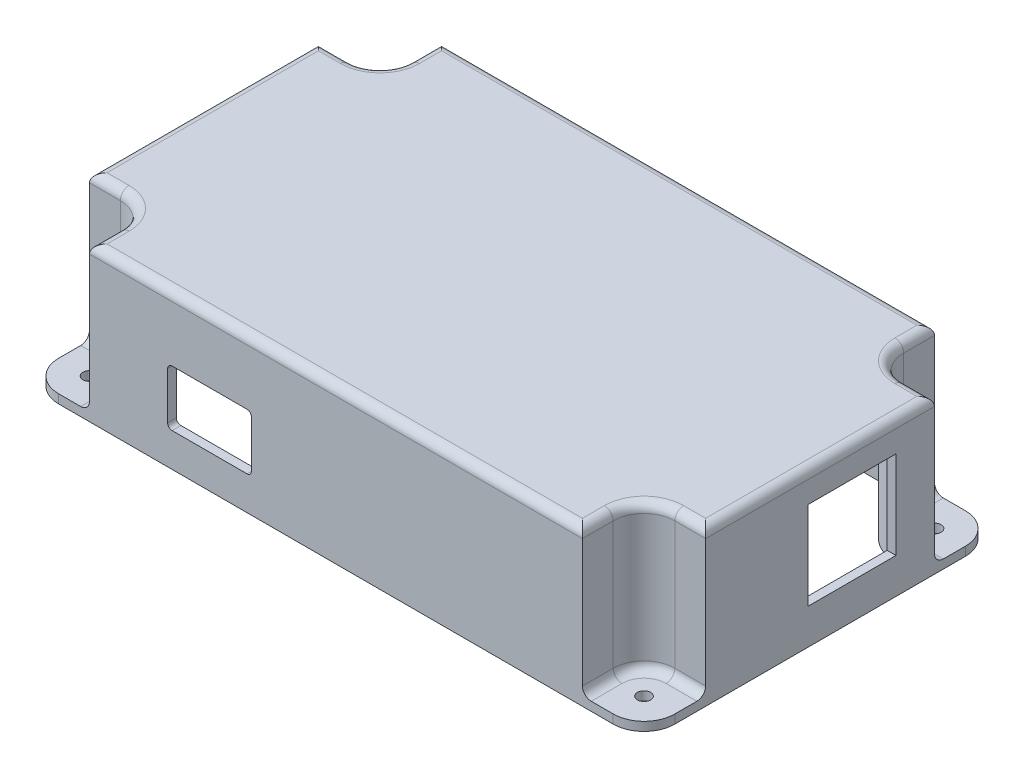
from build123d import *

# Parameters (mm, degrees)
BOSS_EXTRUDE3_DEPTH     = 35
CUT_EXTRUDE4_START      = -33
CUT_EXTRUDE4_DEPTH      = 33
SHELL3_DEPTH            = 33
BOSS_EXTRUDE5_START     = 1
BOSS_EXTRUDE5_DEPTH     = 1
CUT_EXTRUDE5_DEPTH      = 88.114866699
CUT_EXTRUDE5_DEPTH_BACK = 88.114866699
SKETCH10_R              = 1.5
FILLET6_R               = 2
FILLET8_R               = 2
CUT_EXTRUDE7_REACH      = 151.75
SKETCH13_W              = 20
SKETCH13_H              = 20
CUT_EXTRUDE10_REACH     = 113.915
SKETCH16_W              = 19.05
SKETCH16_H              = 12.7
FILLET11_R              = 1


# Read off the part's stored shape, not the designer's step: Shell3
with BuildPart() as part:
    # Sketch4 → Boss-Extrude3 (new body)
    with BuildSketch(Plane(origin=(0, 0, 0), x_dir=(1, 0, 0), z_dir=(0, 1, 0))):
        with BuildLine():
            Line((-63, 40), (63, 40))
            ThreePointArc((63, 40), (67.949747468, 37.949747468), (70, 33))
            Line((70, 33), (70, -33))
            ThreePointArc((70, -33), (67.949747468, -37.949747468), (63, -40))
            Line((63, -40), (-63, -40))
            ThreePointArc((-63, -40), (-67.949747468, -37.949747468), (-70, -33))
            Line((-70, -33), (-70, 33))
            ThreePointArc((-70, 33), (-67.949747468, 37.949747468), (-63, 40))
        make_face()
    extrude(amount=BOSS_EXTRUDE3_DEPTH)

    # Sketch9 → Cut-Extrude4 (cut)
    with BuildSketch(Plane(origin=(0, 35, 0), x_dir=(1, 0, 0), z_dir=(0, 1, 0)).offset(CUT_EXTRUDE4_START)):
        with BuildLine():
            Line((-63, 26), (-70, 26))
            Line((-70, 26), (-70, 33))
            ThreePointArc((-70, 33), (-67.949747468, 37.949747468), (-63, 40))
            Line((-63, 40), (-56, 40))
            Line((-56, 40), (-56, 33))
            ThreePointArc((-56, 33), (-58.050252532, 28.050252532), (-63, 26))
        make_face()
        with BuildLine():
            Line((-63, -26), (-70, -26))
            Line((-70, -26), (-70, -33))
            ThreePointArc((-70, -33), (-67.949747468, -37.949747468), (-63, -40))
            Line((-63, -40), (-56, -40))
            Line((-56, -40), (-56, -33))
            ThreePointArc((-56, -33), (-58.050252532, -28.050252532), (-63, -26))
        make_face()
        with BuildLine():
            Line((56, -33), (56, -40))
            Line((56, -40), (63, -40))
            ThreePointArc((63, -40), (67.949747468, -37.949747468), (70, -33))
            Line((70, -33), (70, -26))
            Line((70, -26), (63, -26))
            ThreePointArc((63, -26), (58.050252532, -28.050252532), (56, -33))
        make_face()
        with BuildLine():
            Line((56, 33), (56, 40))
            Line((56, 40), (63, 40))
            ThreePointArc((63, 40), (67.949747468, 37.949747468), (70, 33))
            Line((70, 33), (70, 26))
            Line((70, 26), (63, 26))
            ThreePointArc((63, 26), (58.050252532, 28.050252532), (56, 33))
        make_face()
    extrude(amount=CUT_EXTRUDE4_DEPTH, mode=Mode.SUBTRACT)

    # Shell3 outline → Shell3 (cut)
    with BuildSketch(Plane(origin=(0, 0, 0), x_dir=(1, 0, 0), z_dir=(0, 1, 0))):
        with BuildLine():
            Line((-68, 24), (-68, -25.516685226))
            ThreePointArc((-68, -25.516685226), (-56.636038969, -26.636038969), (-55.516685226, -38))
            Line((-55.516685226, -38), (55.516685226, -38))
            ThreePointArc((55.516685226, -38), (56.636038969, -26.636038969), (68, -25.516685226))
            Line((68, -25.516685226), (68, 24))
            Line((68, 24), (63, 24))
            ThreePointArc((63, 24), (56.636038969, 26.636038969), (54, 33))
            Line((54, 33), (54, 38))
            Line((54, 38), (-54, 38))
            Line((-54, 38), (-54, 33))
            ThreePointArc((-54, 33), (-56.636038969, 26.636038969), (-63, 24))
            Line((-63, 24), (-68, 24))
        make_face()
    extrude(amount=SHELL3_DEPTH, mode=Mode.SUBTRACT)

    # Sketch11 → Boss-Extrude5 (add)
    with BuildSketch(Plane.XZ.offset(-1).offset(BOSS_EXTRUDE5_START)):
        with BuildLine():
            Line((68, 24), (63, 24))
            ThreePointArc((63, 24), (56.636038969, 26.636038969), (54, 33))
            Line((54, 33), (54, 38))
            Line((54, 38), (63, 38))
            ThreePointArc((63, 38), (66.535533906, 36.535533906), (68, 33))
            Line((68, 33), (68, 24))
        make_face()
        with BuildLine():
            Line((54, -33), (54, -38))
            Line((54, -38), (63, -38))
            ThreePointArc((63, -38), (66.535533906, -36.535533906), (68, -33))
            Line((68, -33), (68, -24))
            Line((68, -24), (63, -24))
            ThreePointArc((63, -24), (56.636038969, -26.636038969), (54, -33))
        make_face()
        with BuildLine():
            Line((-63, -24), (-68, -24))
            Line((-68, -24), (-68, -33))
            ThreePointArc((-68, -33), (-66.535533906, -36.535533906), (-63, -38))
            Line((-63, -38), (-54, -38))
            Line((-54, -38), (-54, -33))
            ThreePointArc((-54, -33), (-56.636038969, -26.636038969), (-63, -24))
        make_face()
        with BuildLine():
            Line((-54, 33), (-54, 38))
            Line((-54, 38), (-63, 38))
            ThreePointArc((-63, 38), (-66.535533906, 36.535533906), (-68, 33))
            Line((-68, 33), (-68, 24))
            Line((-68, 24), (-63, 24))
            ThreePointArc((-63, 24), (-56.636038969, 26.636038969), (-54, 33))
        make_face()
    extrude(amount=-BOSS_EXTRUDE5_DEPTH)

    # Sketch10 → Cut-Extrude5 (cut, two sides: drawn at the far end of the back side and taken through both)
    with BuildSketch(Plane(origin=(0, 2, 0), x_dir=(1, 0, 0), z_dir=(0, 1, 0)).offset(-CUT_EXTRUDE5_DEPTH_BACK)):
        with Locations(Location((-63, 33, 0), (0, 0, 270))):
            Circle(SKETCH10_R)
        with Locations(Location((63, 33, 0), (0, 0, 270))):
            Circle(SKETCH10_R)
        with Locations(Location((63, -33, 0), (0, 0, 270))):
            Circle(SKETCH10_R)
        with Locations(Location((-63, -33, 0), (0, 0, 270))):
            Circle(SKETCH10_R)
    extrude(amount=CUT_EXTRUDE5_DEPTH + CUT_EXTRUDE5_DEPTH_BACK, mode=Mode.SUBTRACT)

    # Fillet6
    fillet6_edges = [part.edges().sort_by_distance(p)[0] for p in [
        (68, 16.5, -24),
        (-54, 16.5, -38),
        (0, 33, -38),
        (-68, 33, 0.758342613),
        (0, 33, 38),
        (68, 33, 0.758342613),
        (-56.636038969, 33, 26.636038969),
        (-56.636038969, 33, -26.636038969),
        (-68, 16.5, -24),
        (-65.5, 33, -24),
        (-54, 33, -35.5),
        (56.636038969, 33, 26.636038969),
        (56.636038969, 33, -26.636038969),
        (54, 16.5, -38),
        (54, 33, -35.5),
        (65.5, 33, -24),
    ]]
    fillet(fillet6_edges, radius=FILLET6_R)

    # Fillet8
    fillet8_edges = [part.edges().sort_by_distance(p)[0] for p in [
        (0, 35, 40),
        (-58.050252532, 35, 28.050252532),
        (-66.5, 35, 26),
        (-56, 35, 36.5),
        (-58.050252532, 2, 28.050252532),
        (-56, 2, 36.5),
        (-66.5, 2, 26),
        (-70, 35, 0),
        (-58.050252532, 35, -28.050252532),
        (-56, 35, -36.5),
        (-66.5, 35, -26),
        (-58.050252532, 2, -28.050252532),
        (-66.5, 2, -26),
        (-56, 2, -36.5),
        (70, 35, 0),
        (58.050252532, 35, 28.050252532),
        (56, 35, 36.5),
        (66.5, 35, 26),
        (58.050252532, 2, 28.050252532),
        (66.5, 2, 26),
        (56, 2, 36.5),
        (0, 35, -40),
        (58.050252532, 35, -28.050252532),
        (66.5, 35, -26),
        (56, 35, -36.5),
        (58.050252532, 2, -28.050252532),
        (56, 2, -36.5),
        (66.5, 2, -26),
    ]]
    fillet(fillet8_edges, radius=FILLET8_R)

    # Sketch13 → Cut-Extrude7 (cut, up to next)
    with BuildSketch(Plane(origin=(70, 0, 0), x_dir=(0, 0, -1), z_dir=(1, 0, 0)), mode=Mode.PRIVATE) as cut_extrude7_sk1:
        with Locations((7.25040296, 18.065666935)):
            Rectangle(SKETCH13_W, SKETCH13_H)
    cut_extrude7_tool1 = extrude(cut_extrude7_sk1.sketch, amount=-CUT_EXTRUDE7_REACH, mode=Mode.PRIVATE) & part.part
    add(cut_extrude7_tool1.solids().sort_by_distance((70, 18.065667, -7.250403))[0], mode=Mode.SUBTRACT)

    # Sketch16 → Cut-Extrude10 (cut, up to next)
    with BuildSketch(Plane.XY.offset(40), mode=Mode.PRIVATE) as cut_extrude10_sk1:
        with Locations((-28.725, 14)):
            Rectangle(SKETCH16_W, SKETCH16_H)
    cut_extrude10_tool1 = extrude(cut_extrude10_sk1.sketch, amount=-CUT_EXTRUDE10_REACH, mode=Mode.PRIVATE) & part.part
    add(cut_extrude10_tool1.solids().sort_by_distance((-28.725, 14, 40))[0], mode=Mode.SUBTRACT)

    # Fillet11
    fillet11_edges = [part.edges().sort_by_distance(p)[0] for p in [
        (-19.2, 20.35, 39),
        (-19.2, 7.65, 39),
        (-38.25, 7.65, 39),
        (-38.25, 20.35, 39),
    ]]
    fillet(fillet11_edges, radius=FILLET11_R)


solid = part.part
